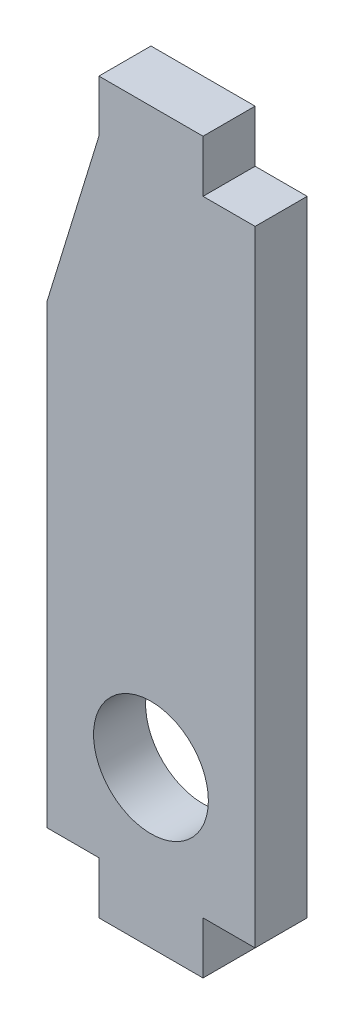
from build123d import *

# Parameters (mm, degrees)
BOSS_EXTRUDE1_DEPTH = 6.35
SKETCH2_R           = 6.99999997
CUT_EXTRUDE1_DEPTH  = 47.6627796


with BuildPart() as part:
    # Sketch1 → Boss-Extrude1 (new body)
    with BuildSketch(Plane.XY):
        Polygon((-12.7, 38.1), (-12.7, -38.1), (-6.35, -38.1), (-6.35, -44.45), (6.35, -44.45), (6.35, -38.1), (12.7, -38.1), (12.7, 38.1), (6.35, 38.1), (6.35, 44.45), (-6.35, 44.45), (-6.35, 38.1), align=None)
    extrude(amount=BOSS_EXTRUDE1_DEPTH)

    # Sketch2 → Cut-Extrude1 (cut, through all)
    with BuildSketch(Plane.XY.offset(6.35)):
        with Locations((0, -25.4)):
            Circle(SKETCH2_R)
        Polygon((-6.35, 38.1), (-12.7, 17.409172636), (-12.7, 38.1), align=None)
    extrude(amount=-CUT_EXTRUDE1_DEPTH, mode=Mode.SUBTRACT)


solid = part.part
